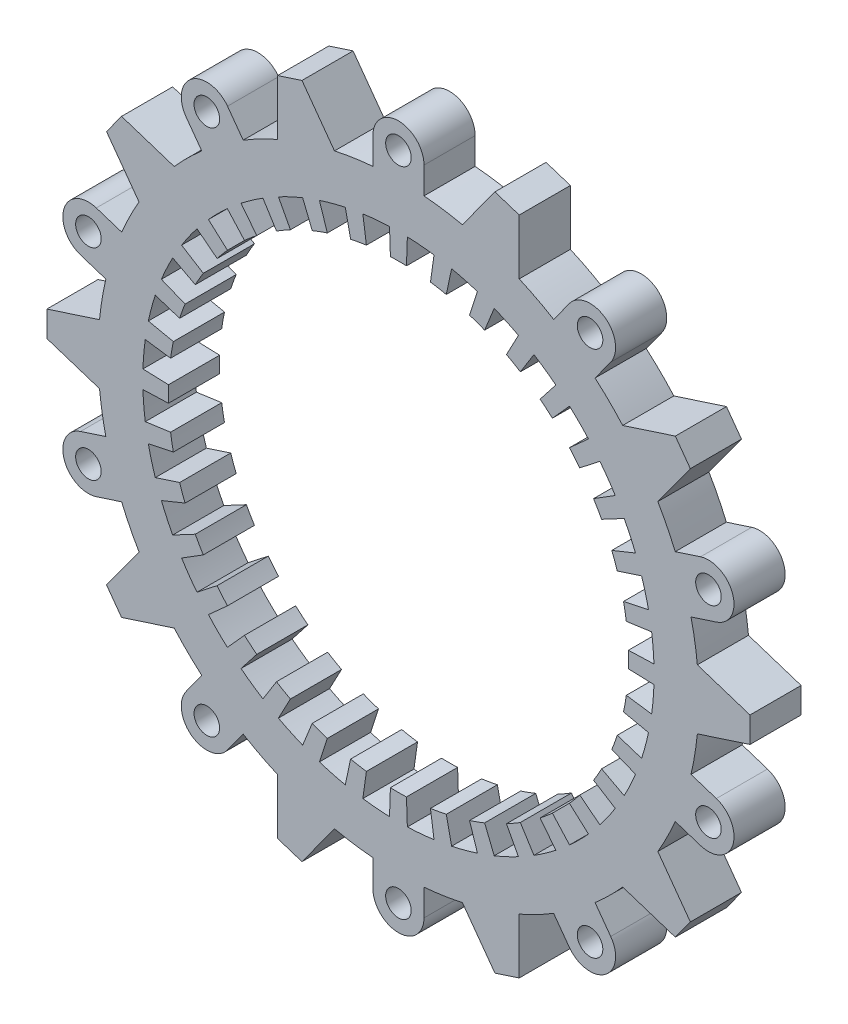
from build123d import *

# Parameters (mm, degrees)
BOSS_EXTRUDE2_DEPTH = 4
BOSS_EXTRUDE3_DEPTH = 4
CIRPATTERN1_COUNT   = 36
SKETCH3_5_R         = 1
BOSS_EXTRUDE4_DEPTH = 4
CIRPATTERN2_COUNT   = 10
BOSS_EXTRUDE5_DEPTH = 4
CIRPATTERN3_COUNT   = 10


with BuildPart() as part:
    # Sketch3 → Boss-Extrude2 (new body)
    with BuildSketch(Plane.XY):
        with BuildLine():
            ThreePointArc((-3.3e-08, 23.5), (-1.000908285, 23.478675061), (-2, 23.414738948))
            ThreePointArc((-2, 23.414738948), (-23.183557089, 3.843524514), (-9.449023862, -21.516643513))
            ThreePointArc((-9.449023862, -21.516643513), (-7.261899368, -22.349828133), (-5.002744851, -22.961327138))
            ThreePointArc((-5.002744851, -22.961327138), (14.742548898, -18.30047136), (23.5, 0))
            ThreePointArc((23.5, 0), (17.309679373, 15.894181325), (2, 23.414738948))
            ThreePointArc((2, 23.414738948), (1.000908252, 23.478675062), (-3.3e-08, 23.5))
        make_face()
        with BuildLine():
            ThreePointArc((20, 0), (-13.893167409, -14.386796007), (-0.697989934, 19.98781654))
            ThreePointArc((-0.697989934, 19.98781654), (0, 20), (0.697989934, 19.98781654))
            ThreePointArc((0.697989934, 19.98781654), (14.386796007, 13.893167409), (20, 0))
        make_face(mode=Mode.SUBTRACT)
    extrude(amount=BOSS_EXTRUDE2_DEPTH)

    # Sketch3<4> → Boss-Extrude3 (add)
    with BuildSketch(Plane.XY):
        with BuildLine():
            Line((-0.697989934, 19.98781654), (-0.628190941, 17.989034886))
            ThreePointArc((-0.628190941, 17.989034886), (0, 18), (0.628190941, 17.989034886))
            Line((0.628190941, 17.989034886), (0.697989934, 19.98781654))
            ThreePointArc((0.697989934, 19.98781654), (0, 20), (-0.697989934, 19.98781654))
        make_face()
    boss_extrude3 = extrude(amount=BOSS_EXTRUDE3_DEPTH)

    # CirPattern1: Boss-Extrude3 ×36 about axis
    cirpattern1_axis = Axis((0, 0, 0), (0, 0, 1))
    for i in range(1, CIRPATTERN1_COUNT):
        add(boss_extrude3.rotate(cirpattern1_axis, i * 360 / CIRPATTERN1_COUNT))

    # Sketch3<5> → Boss-Extrude4 (add)
    with BuildSketch(Plane.XY):
        with BuildLine():
            ThreePointArc((-2, 23.414738948), (0, 23.5), (2, 23.414738948))
            Line((2, 23.414738948), (2, 25.5))
            ThreePointArc((2, 25.5), (0, 27.5), (-2, 25.5))
            Line((-2, 25.5), (-2, 23.414738948))
        make_face()
        with Locations((0, 25.5)):
            Circle(SKETCH3_5_R, mode=Mode.SUBTRACT)
    boss_extrude4 = extrude(amount=BOSS_EXTRUDE4_DEPTH)

    # CirPattern2: Boss-Extrude4 ×10 about axis
    cirpattern2_axis = Axis((0, 0, 0), (0, 0, 1))
    for i in range(1, CIRPATTERN2_COUNT):
        add(boss_extrude4.rotate(cirpattern2_axis, i * 360 / CIRPATTERN2_COUNT))

    # Sketch3<6> → Boss-Extrude5 (add)
    with BuildSketch(Plane.XY):
        with BuildLine():
            ThreePointArc((-5.002744851, -22.961327138), (-7.261899368, -22.349828133), (-9.449023862, -21.516643513))
            Line((-9.449023862, -21.516643513), (-9.449023862, -25.845037204))
            Line((-9.449023862, -25.845037204), (-7.546910829, -26.463071192))
            Line((-7.546910829, -26.463071192), (-5.002744851, -22.961327138))
        make_face()
    boss_extrude5 = extrude(amount=BOSS_EXTRUDE5_DEPTH)

    # CirPattern3: Boss-Extrude5 ×10 about axis
    cirpattern3_axis = Axis((0, 0, 0), (0, 0, 1))
    for i in range(1, CIRPATTERN3_COUNT):
        add(boss_extrude5.rotate(cirpattern3_axis, i * 360 / CIRPATTERN3_COUNT))


solid = part.part
